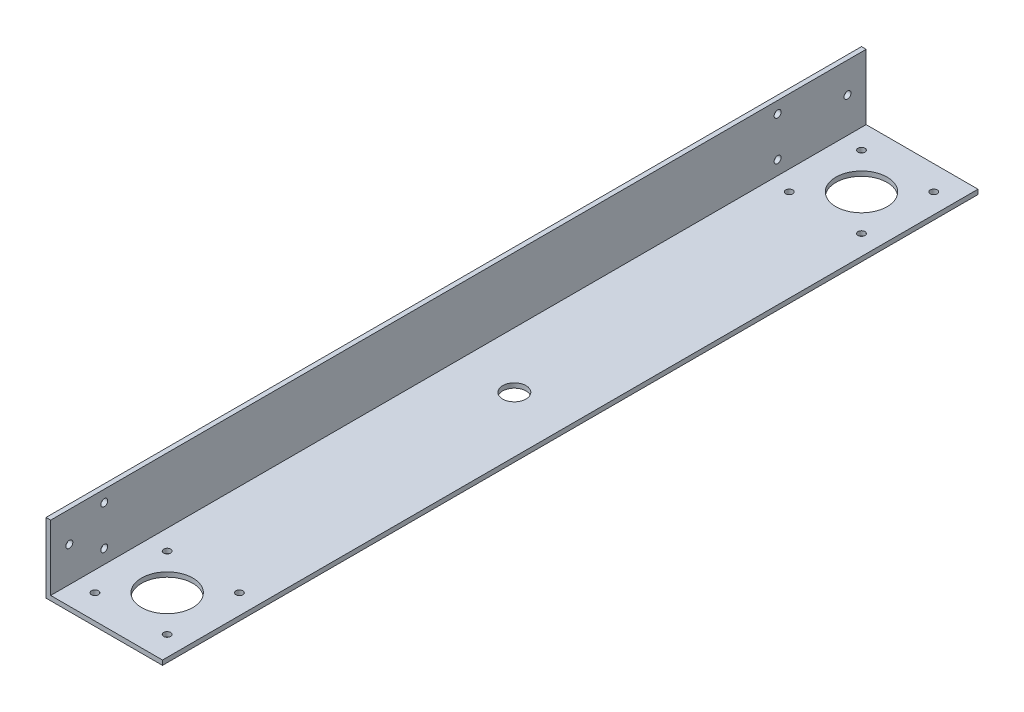
from build123d import *

# Parameters (mm, degrees)
BOSS_EXTRUDE1_DEPTH      = 350
SKETCH6_R                = 1.5
CUT_EXTRUDE3_DEPTH       = 355.660400947
SKETCH7_R                = 11
CUT_EXTRUDE4_DEPTH       = 355.660400947
SKETCH8_R                = 11
CUT_EXTRUDE5_DEPTH       = 355.823899984
SKETCH9_R                = 1.5
CUT_EXTRUDE6_DEPTH       = 355.823899984
SKETCH10_R               = 5
CUT_EXTRUDE7_DEPTH       = 355.823899984
F_3_0_3_DIAMETER_HOLE1_D = 3
F_3_0_3_DIAMETER_HOLE2_D = 3


with BuildPart() as part:
    # Sketch1 → Boss-Extrude1 (new body)
    with BuildSketch(Plane.XY):
        Polygon((0, 0), (0, 30), (2, 30), (2, 2), (50, 2), (50, 0), align=None)
    extrude(amount=BOSS_EXTRUDE1_DEPTH)

    # Sketch6 → Cut-Extrude3 (cut, through all)
    with BuildSketch(Plane(origin=(0, 2, 0), x_dir=(1, 0, 0), z_dir=(0, 1, 0))):
        with Locations((41.5, -339.5)):
            Circle(SKETCH6_R)
        with Locations((10.5, -308.5)):
            Circle(SKETCH6_R)
        with Locations((10.5, -339.5)):
            Circle(SKETCH6_R)
        with Locations((41.5, -308.5)):
            Circle(SKETCH6_R)
    extrude(amount=-CUT_EXTRUDE3_DEPTH, mode=Mode.SUBTRACT)

    # Sketch7 → Cut-Extrude4 (cut, through all)
    with BuildSketch(Plane(origin=(0, 2, 0), x_dir=(1, 0, 0), z_dir=(0, 1, 0))):
        with Locations((26, -324)):
            Circle(SKETCH7_R)
    extrude(amount=-CUT_EXTRUDE4_DEPTH, mode=Mode.SUBTRACT)

    # Sketch8 → Cut-Extrude5 (cut, through all)
    with BuildSketch(Plane(origin=(0, 0, 0), x_dir=(-1, 0, 0), z_dir=(0, -1, 0))):
        with Locations((-26, -26)):
            Circle(SKETCH8_R)
    extrude(amount=-CUT_EXTRUDE5_DEPTH, mode=Mode.SUBTRACT)

    # Sketch9 → Cut-Extrude6 (cut, through all)
    with BuildSketch(Plane.XZ):
        with Locations((41.5, 41.5)):
            Circle(SKETCH9_R)
        with Locations((10.5, 41.5)):
            Circle(SKETCH9_R)
        with Locations((10.5, 10.5)):
            Circle(SKETCH9_R)
        with Locations((41.5, 10.5)):
            Circle(SKETCH9_R)
    extrude(amount=-CUT_EXTRUDE6_DEPTH, mode=Mode.SUBTRACT)

    # Sketch10 → Cut-Extrude7 (cut, through all)
    with BuildSketch(Plane.XZ):
        with Locations((26.000000572, 175)):
            Circle(SKETCH10_R)
    extrude(amount=-CUT_EXTRUDE7_DEPTH, mode=Mode.SUBTRACT)

    # Ø3.0 (3) Diameter Hole1 (through all)
    with Locations(Plane(origin=(0, 141.67995168, 221.138003919), x_dir=(0, 0, 1), z_dir=(-1, 0, 0))):
        with Locations((105.861996081, -133.67995168), (120.861996081, -124.67995168), (105.861996081, -116.67995168)):
            Hole(F_3_0_3_DIAMETER_HOLE1_D / 2)

    # Ø3.0 (3) Diameter Hole2 (through all)
    with Locations(Plane(origin=(0, 141.67995168, 221.138003919), x_dir=(0, 0, 1), z_dir=(-1, 0, 0))):
        with Locations((-183.138003919, -133.67995168), (-213.138003919, -124.67995168), (-183.138003919, -116.67995168)):
            Hole(F_3_0_3_DIAMETER_HOLE2_D / 2)


solid = part.part
